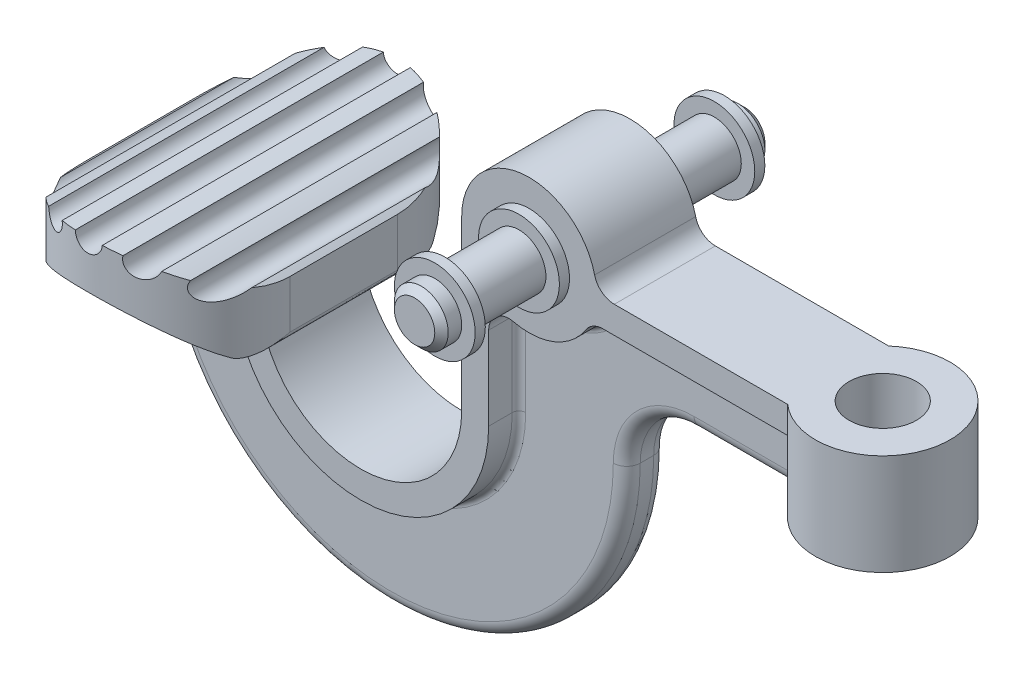
from build123d import *

# Parameters (mm, degrees)
SKETCH1_R                = 10
SKETCH1_R_2              = 5
BOSS_EXTRUDE1_DEPTH      = 15
BOSS_EXTRUDE2_DEPTH      = 7.5
BOSS_EXTRUDE3_DEPTH      = 3
DELETEFACE1_START        = -15
DELETEFACE1_DEPTH        = 15
BOSS_EXTRUDE4_DEPTH      = 23
FILLET1_R                = 2
FILLET2_R                = 1
SKETCH3_W                = 45
SKETCH3_H                = 60
CUT_EXTRUDE1_DEPTH       = 32
SKETCH4_R                = 6
SKETCH4_R_2              = 4
BOSS_EXTRUDE5_DEPTH      = 1.5
SKETCH4_2_R              = 4
BOSS_EXTRUDE6_DEPTH      = 17
BOSS_EXTRUDE7_START      = 12.5
SKETCH4_3_R              = 6
SKETCH4_3_R_2            = 4
BOSS_EXTRUDE7_DEPTH      = 1.5
CHAMFER1_SIZE            = 1
CHAMFER1_OF_MIRROR1_SIZE = 1


# Read off the part's stored shape, not the designer's step: DeleteFace1
with BuildPart() as part:
    # Sketch1 → Boss-Extrude1 (new body)
    with BuildSketch(Plane(origin=(0, 0, 0), x_dir=(1, 0, 0), z_dir=(0, 1, 0))):
        with Locations(Location((0, 0, 0), (0, 0, 270))):
            Circle(SKETCH1_R)
        with Locations(Location((0, 0, 0), (0, 0, 270))):
            Circle(SKETCH1_R_2, mode=Mode.SUBTRACT)
    extrude(amount=-BOSS_EXTRUDE1_DEPTH)

    # Sketch2 → Boss-Extrude2 (add, symmetric)
    with BuildSketch(Plane.XY):
        with BuildLine():
            Line((0, 0), (-32.350889359, 0))
            ThreePointArc((-32.350889359, 0), (-34.211410378, 0.646606378), (-35.269914892, 2.307692308))
            ThreePointArc((-35.269914892, 2.307692308), (-46.161711866, 9.932292059), (-55, 0))
            Line((-55, 0), (-55, -25))
            ThreePointArc((-55, -25), (-69.983302344, -39.999990706), (-84.999962825, -25.033395291))
            ThreePointArc((-84.999962825, -25.033395291), (-86.890607937, -23.930222143), (-88.901180192, -23.064699679))
            ThreePointArc((-88.901180192, -23.064699679), (-70.968910817, -43.975278966), (-51, -25))
            Line((-51, -25), (-51, -12.649110641))
            ThreePointArc((-51, -12.649110641), (-49.860521019, -10.295717019), (-47.307692308, -9.730085108))
            ThreePointArc((-47.307692308, -9.730085108), (-41.247569937, -9.269264729), (-36.573499115, -5.384615385))
            ThreePointArc((-36.573499115, -5.384615385), (-35.486702234, -4.368825942), (-34.04554885, -4))
            Line((-34.04554885, -4), (0, -4))
            Line((0, -4), (0, 0))
        make_face()
    extrude(amount=BOSS_EXTRUDE2_DEPTH, both=True)

    # Sketch2<4> → Boss-Extrude3 (add, symmetric)
    with BuildSketch(Plane.XY):
        with BuildLine():
            Line((0, -15), (0, -4))
            Line((0, -4), (-34.04554885, -4))
            ThreePointArc((-34.04554885, -4), (-35.486702234, -4.368825942), (-36.573499115, -5.384615385))
            ThreePointArc((-36.573499115, -5.384615385), (-41.247569937, -9.269264729), (-47.307692308, -9.730085108))
            ThreePointArc((-47.307692308, -9.730085108), (-49.860521019, -10.295717019), (-51, -12.649110641))
            Line((-51, -12.649110641), (-51, -25))
            ThreePointArc((-51, -25), (-70.968910817, -43.975278966), (-88.901180192, -23.064699679))
            ThreePointArc((-88.901180192, -23.064699679), (-97.184874461, -22.13309418), (-104.999984102, -25.03335983))
            ThreePointArc((-104.999984102, -25.03335983), (-69.983320083, -59.999996025), (-35, -25))
            ThreePointArc((-35, -25), (-32.071067812, -17.928932188), (-25, -15))
            Line((-25, -15), (0, -15))
        make_face()
    extrude(amount=BOSS_EXTRUDE3_DEPTH, both=True)

    # DeleteFace1 outline → DeleteFace1 (cut)
    with BuildSketch(Plane(origin=(0, 0, 0), x_dir=(1, 0, 0), z_dir=(0, 1, 0)).offset(DELETEFACE1_START)):
        with BuildLine():
            ThreePointArc((0, 5), (-5, 0), (0, -5))
            Line((0, -5), (0, 5))
        make_face()
    extrude(amount=DELETEFACE1_DEPTH, mode=Mode.SUBTRACT)

    # Sketch2<5> → Boss-Extrude4 (add, symmetric)
    with BuildSketch(Plane.XY):
        with BuildLine():
            ThreePointArc((-88.901180192, -23.064699679), (-86.890607937, -23.930222143), (-84.999962825, -25.033395291))
            ThreePointArc((-84.999962825, -25.033395291), (-83.284605228, -26.334366998), (-81.736842105, -27.830832294))
            ThreePointArc((-81.736842105, -27.830832294), (-80.637261875, -28.086658538), (-80, -27.154767421))
            Line((-80, -27.154767421), (-80, -20))
            ThreePointArc((-80, -20), (-80.401765491, -19.704888539), (-80.809335388, -19.417846617))
            ThreePointArc((-80.809335388, -19.417846617), (-83.5, -20.081415713), (-84.270664612, -17.419447258))
            ThreePointArc((-84.270664612, -17.419447258), (-85.432914191, -16.903011687), (-86.619923843, -16.446352223))
            ThreePointArc((-86.619923843, -16.446352223), (-89.047161963, -17.783705995), (-90.480534949, -15.411904595))
            ThreePointArc((-90.480534949, -15.411904595), (-91.736845194, -15.213878466), (-93.001600641, -15.08))
            ThreePointArc((-93.001600641, -15.08), (-95, -17), (-96.998399359, -15.08))
            ThreePointArc((-96.998399359, -15.08), (-98.263154806, -15.213878466), (-99.519465051, -15.411904595))
            ThreePointArc((-99.519465051, -15.411904595), (-99.482761089, -15.630519927), (-99.470476128, -15.851854343))
            ThreePointArc((-99.470476128, -15.851854343), (-101.169810248, -17.829125196), (-103.380076157, -16.446352223))
            ThreePointArc((-103.380076157, -16.446352223), (-104.567085809, -16.903011687), (-105.729335388, -17.419447258))
            ThreePointArc((-105.729335388, -17.419447258), (-105.558180077, -17.87047516), (-105.5, -18.349364905))
            ThreePointArc((-105.5, -18.349364905), (-106.943820723, -20.27047516), (-109.190664612, -19.417846617))
            ThreePointArc((-109.190664612, -19.417846617), (-109.598234509, -19.704888539), (-110, -20))
            Line((-110, -20), (-110, -27.154767421))
            ThreePointArc((-110, -27.154767421), (-109.362738125, -28.086658538), (-108.263157895, -27.830832294))
            ThreePointArc((-108.263157895, -27.830832294), (-106.715370542, -26.334346226), (-104.999984102, -25.03335983))
            ThreePointArc((-104.999984102, -25.03335983), (-97.184874461, -22.13309418), (-88.901180192, -23.064699679))
        make_face()
    extrude(amount=BOSS_EXTRUDE4_DEPTH, both=True)

    # Fillet1
    fillet1_edges = [part.edges().sort_by_distance(p)[0] for p in [
        (-69.983320083, -59.999996025, 3),
        (-32.071067812, -17.928932188, -3),
        (-17.269696007, -15, -3),
        (-17.269696007, -15, 3),
        (-32.071067812, -17.928932188, 3),
        (-69.983320083, -59.999996025, -3),
    ]]
    fillet(fillet1_edges, radius=FILLET1_R)

    # Fillet2
    fillet2_edges = [part.edges().sort_by_distance(p)[0] for p in [
        (-21.792470432, -4, -3),
        (-21.792470432, -4, 3),
        (-35.486702234, -4.368825942, -3),
        (-41.247569937, -9.269264729, 3),
        (-49.860521019, -10.295717019, 3),
        (-51, -18.82455532, -3),
        (-70.968910817, -43.975278966, -3),
        (-35.486702234, -4.368825942, 3),
        (-51, -18.82455532, 3),
        (-70.968910817, -43.975278966, 3),
        (-49.860521019, -10.295717019, -3),
        (-41.247569937, -9.269264729, -3),
    ]]
    fillet(fillet2_edges, radius=FILLET2_R)

    # Sketch3 → Cut-Extrude1 (cut)
    with BuildSketch(Plane(origin=(0, 0, 0), x_dir=(1, 0, 0), z_dir=(0, 1, 0))):
        with Locations((-95, 0)):
            Rectangle(SKETCH3_W, SKETCH3_H)
        with BuildLine():
            Line((-110, 8), (-110, -8))
            ThreePointArc((-110, -8), (-95, -23), (-80, -8))
            Line((-80, -8), (-80, 8))
            ThreePointArc((-80, 8), (-95, 23), (-110, 8))
        make_face(mode=Mode.SUBTRACT)
    extrude(amount=-CUT_EXTRUDE1_DEPTH, mode=Mode.SUBTRACT)

    # Sketch4 → Boss-Extrude5 (add)
    with BuildSketch(Plane.XY.offset(7.5)):
        with Locations((-45, 0)):
            Circle(SKETCH4_R)
        with Locations((-45, 0)):
            Circle(SKETCH4_R_2, mode=Mode.SUBTRACT)
    boss_extrude5 = extrude(amount=BOSS_EXTRUDE5_DEPTH)

    # Sketch4<2> → Boss-Extrude6 (add)
    with BuildSketch(Plane.XY.offset(7.5)):
        with Locations((-45, 0)):
            Circle(SKETCH4_2_R)
    boss_extrude6 = extrude(amount=BOSS_EXTRUDE6_DEPTH)

    # Sketch4<3> → Boss-Extrude7 (add)
    with BuildSketch(Plane.XY.offset(7.5).offset(BOSS_EXTRUDE7_START)):
        with Locations((-45, 0)):
            Circle(SKETCH4_3_R)
        with Locations((-45, 0)):
            Circle(SKETCH4_3_R_2, mode=Mode.SUBTRACT)
    boss_extrude7 = extrude(amount=BOSS_EXTRUDE7_DEPTH)

    # Chamfer1
    chamfer1_edges = [part.edges().sort_by_distance(p)[0] for p in [
        (-49, 0, 24.5),
    ]]
    chamfer(chamfer1_edges, length=CHAMFER1_SIZE)

    # Mirror1: Boss-Extrude5, Boss-Extrude6, Boss-Extrude7 across plane
    add(boss_extrude5.mirror(Plane.XY))
    add(boss_extrude6.mirror(Plane.XY))
    add(boss_extrude7.mirror(Plane.XY))

    # Chamfer1 of Mirror1
    chamfer1_of_mirror1_edges = [part.edges().sort_by_distance(p)[0] for p in [
        (-49, 0, -24.5),
    ]]
    chamfer(chamfer1_of_mirror1_edges, length=CHAMFER1_OF_MIRROR1_SIZE)


solid = part.part
